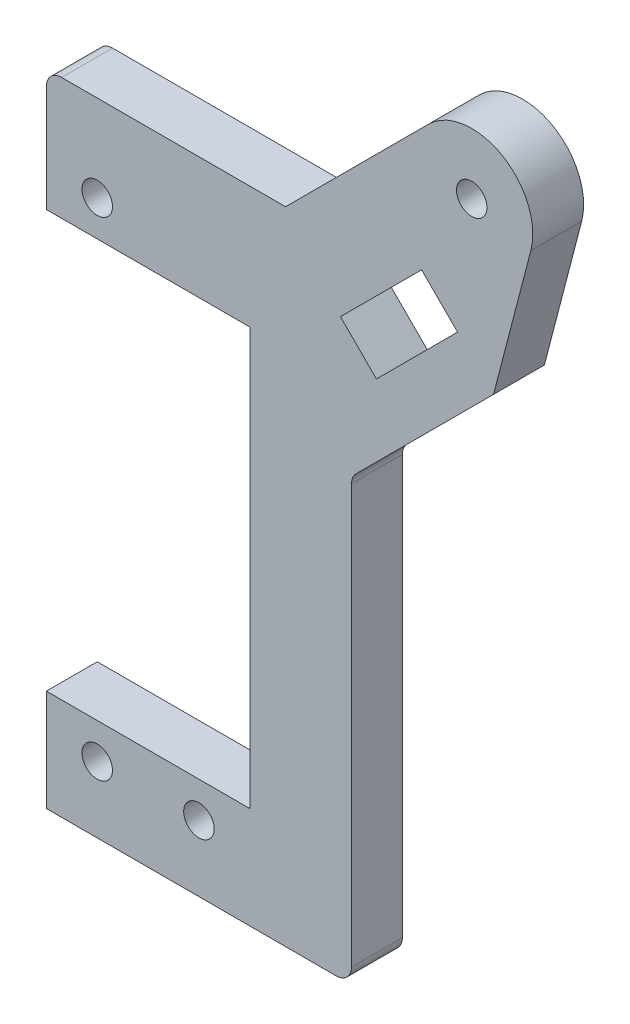
from build123d import *

# Parameters (mm, degrees)
ESQUISSE1_R        = 1.5
BOSS_EXTRU_1_DEPTH = 5
CONG_3_R           = 1.5


with BuildPart() as part:
    # Esquisse1 → Boss.-Extru.1 (new body)
    with BuildSketch(Plane.XY):
        with BuildLine():
            Line((11, 10), (0, 10))
            Line((0, 10), (0, 0))
            Line((0, 0), (30, 0))
            Line((30, 0), (30, 43.28152075))
            Line((30, 43.28152075), (43.961530357, 57.243051107))
            Line((43.961530357, 57.243051107), (47.625955008, 71.306985316))
            ThreePointArc((47.625955008, 71.306985316), (44.801829917, 78.026294211), (37.577164466, 77.06244584))
            Line((37.577164466, 77.06244584), (23.514718626, 63))
            Line((23.514718626, 63), (0, 63))
            Line((0, 63), (0, 51))
            Line((0, 51), (11, 51))
            Line((11, 51), (20, 51))
            Line((20, 51), (20, 10))
            Line((20, 10), (11, 10))
        make_face()
        with Locations((5, 6.5)):
            Circle(ESQUISSE1_R, mode=Mode.SUBTRACT)
        with Locations((15, 6.5)):
            Circle(ESQUISSE1_R, mode=Mode.SUBTRACT)
        with Locations((5, 54.5)):
            Circle(ESQUISSE1_R, mode=Mode.SUBTRACT)
        Polygon((28.912098666, 56.33575504), (36.890462545, 64.314118919), (40.425996451, 60.778585013), (32.447632572, 52.800221134), align=None, mode=Mode.SUBTRACT)
        with Locations((41.819805153, 72.819805153)):
            Circle(ESQUISSE1_R, mode=Mode.SUBTRACT)
    extrude(amount=BOSS_EXTRU_1_DEPTH)

    # Congé3
    cong_3_edges = [part.edges().sort_by_distance(p)[0] for p in [
        (0, 63, 2.5),
        (30, 0, 2.5),
        (30, 43.28152075, 2.5),
    ]]
    fillet(cong_3_edges, radius=CONG_3_R)


solid = part.part
